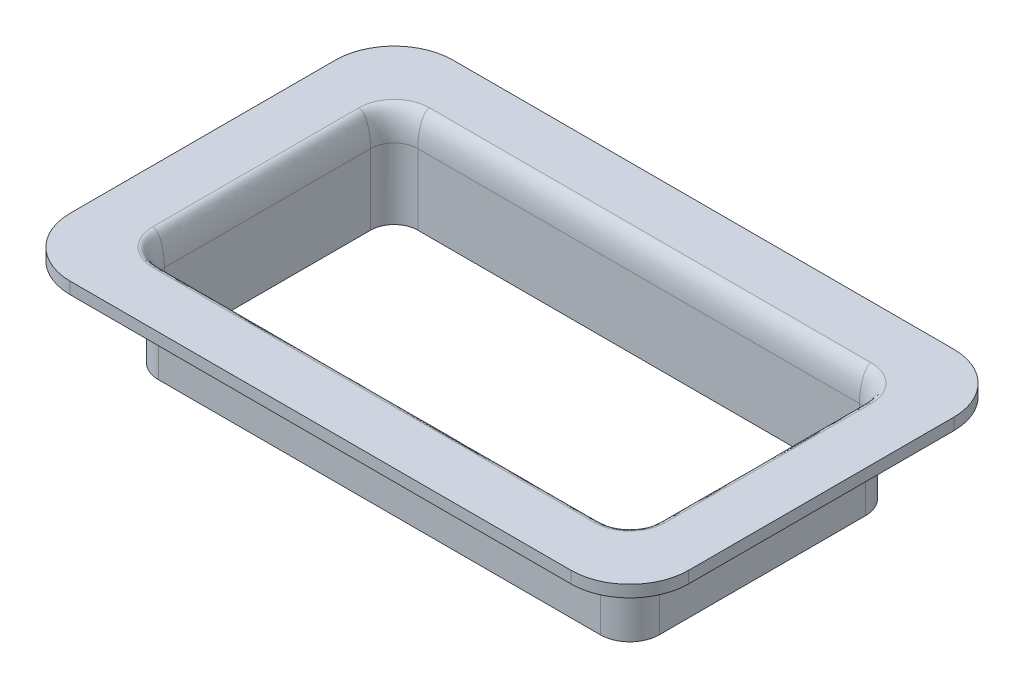
from build123d import *

# Parameters (mm, degrees)
BOSS_EXTRUDE1_DEPTH = 19.05
BOSS_EXTRUDE2_DEPTH = 2.54
FILLET1_R           = 6.35
FILLET3_SIZE        = 6.35
FILLET3_SIZE_2      = 2.54


with BuildPart() as part:
    # Sketch1 → Boss-Extrude1 (new body)
    with BuildSketch(Plane(origin=(0, 0, 0), x_dir=(1, 0, 0), z_dir=(0, 1, 0))):
        with BuildLine():
            Line((-47.625, 28.575), (47.625, 28.575))
            ThreePointArc((47.625, 28.575), (52.115128061, 26.715128061), (53.975, 22.225))
            Line((53.975, 22.225), (53.975, -22.225))
            ThreePointArc((53.975, -22.225), (52.115128061, -26.715128061), (47.625, -28.575))
            Line((47.625, -28.575), (-47.625, -28.575))
            ThreePointArc((-47.625, -28.575), (-52.115128061, -26.715128061), (-53.975, -22.225))
            Line((-53.975, -22.225), (-53.975, 22.225))
            ThreePointArc((-53.975, 22.225), (-52.115128061, 26.715128061), (-47.625, 28.575))
        make_face()
        with BuildLine():
            Line((-52.705, 22.225), (-52.705, -22.225))
            ThreePointArc((-52.705, -22.225), (-51.217102448, -25.817102448), (-47.625, -27.305))
            Line((-47.625, -27.305), (47.625, -27.305))
            ThreePointArc((47.625, -27.305), (51.217102448, -25.817102448), (52.705, -22.225))
            Line((52.705, -22.225), (52.705, 22.225))
            ThreePointArc((52.705, 22.225), (51.217102448, 25.817102448), (47.625, 27.305))
            Line((47.625, 27.305), (-47.625, 27.305))
            ThreePointArc((-47.625, 27.305), (-51.217102448, 25.817102448), (-52.705, 22.225))
        make_face(mode=Mode.SUBTRACT)
    extrude(amount=BOSS_EXTRUDE1_DEPTH)

    # Sketch2 → Boss-Extrude2 (add)
    with BuildSketch(Plane(origin=(0, 19.05, 0), x_dir=(1, 0, 0), z_dir=(0, 1, 0))):
        with BuildLine():
            Line((-53.975, -41.275), (53.975, -41.275))
            ThreePointArc((53.975, -41.275), (62.955256121, -37.555256121), (66.675, -28.575))
            Line((66.675, -28.575), (66.675, 28.575))
            ThreePointArc((66.675, 28.575), (62.955256121, 37.555256121), (53.975, 41.275))
            Line((53.975, 41.275), (-53.975, 41.275))
            ThreePointArc((-53.975, 41.275), (-62.955256121, 37.555256121), (-66.675, 28.575))
            Line((-66.675, 28.575), (-66.675, -28.575))
            ThreePointArc((-66.675, -28.575), (-62.955256121, -37.555256121), (-53.975, -41.275))
        make_face()
        with BuildLine():
            Line((52.705, -22.225), (52.705, 22.225))
            ThreePointArc((52.705, 22.225), (51.217102448, 25.817102448), (47.625, 27.305))
            Line((47.625, 27.305), (-47.625, 27.305))
            ThreePointArc((-47.625, 27.305), (-51.217102448, 25.817102448), (-52.705, 22.225))
            Line((-52.705, 22.225), (-52.705, -22.225))
            ThreePointArc((-52.705, -22.225), (-51.217102448, -25.817102448), (-47.625, -27.305))
            Line((-47.625, -27.305), (47.625, -27.305))
            ThreePointArc((47.625, -27.305), (51.217102448, -25.817102448), (52.705, -22.225))
        make_face(mode=Mode.SUBTRACT)
    extrude(amount=BOSS_EXTRUDE2_DEPTH)

    # Fillet1
    fillet1_edges = [part.edges().sort_by_distance(p)[0] for p in [
        (-52.115128061, 19.05, -26.715128061),
        (-53.975, 19.05, 0),
        (-52.115128061, 19.05, 26.715128061),
        (0, 19.05, 28.575),
        (52.115128061, 19.05, 26.715128061),
        (53.975, 19.05, 0),
        (52.115128061, 19.05, -26.715128061),
        (0, 19.05, -28.575),
    ]]
    fillet(fillet1_edges, radius=FILLET1_R)

    # Fillet3
    # an asymmetric fillet: 6.35, 2.54 mm, written as the material it takes off along each edge
    with BuildSketch(Plane(origin=(47.625, 21.59, -22.225), x_dir=(1, 0, 0), z_dir=(0, 0, 1))) as fillet3_piece_1:
        with BuildLine():
            Bezier((5.08, -FILLET3_SIZE), (5.08, 0), (5.08 + FILLET3_SIZE_2, 0), weights=[1, 0.707106781, 1])
            Line((5.08 + FILLET3_SIZE_2, 0), (5.08, 0))
            Line((5.08, 0), (5.08, -FILLET3_SIZE))
        make_face()
    revolve(axis=Axis((47.625, 21.59, -22.225), (0, 1, 0)), revolution_arc=90, mode=Mode.SUBTRACT)
    with BuildSketch(Plane(origin=(52.705, 21.59, 22.225), x_dir=(0, -1, 0), z_dir=(0, 0, -1)), Plane(origin=(-52.705, 21.59, -22.225), x_dir=(0, -1, 0), z_dir=(0, 0, 1))) as fillet3_piece_2:
        with BuildLine():
            Bezier((FILLET3_SIZE, 0), (0, 0), (0, -FILLET3_SIZE_2), weights=[1, 0.707106781, 1])
            Line((0, -FILLET3_SIZE_2), (0, 0))
            Line((0, 0), (FILLET3_SIZE, 0))
        make_face()
    extrude(amount=44.45, mode=Mode.SUBTRACT)
    with BuildSketch(Plane(origin=(47.625, 21.59, 22.225), x_dir=(0, 0, 1), z_dir=(-1, 0, 0))) as fillet3_piece_3:
        with BuildLine():
            Bezier((5.08, -FILLET3_SIZE), (5.08, 0), (5.08 + FILLET3_SIZE_2, 0), weights=[1, 0.707106781, 1])
            Line((5.08 + FILLET3_SIZE_2, 0), (5.08, 0))
            Line((5.08, 0), (5.08, -FILLET3_SIZE))
        make_face()
    revolve(axis=Axis((47.625, 21.59, 22.225), (0, 1, 0)), revolution_arc=90, mode=Mode.SUBTRACT)
    with BuildSketch(Plane(origin=(-47.625, 21.59, 27.305), x_dir=(0, -1, 0), z_dir=(1, 0, 0)), Plane(origin=(47.625, 21.59, -27.305), x_dir=(0, -1, 0), z_dir=(-1, 0, 0))) as fillet3_piece_4:
        with BuildLine():
            Bezier((FILLET3_SIZE, 0), (0, 0), (0, -FILLET3_SIZE_2), weights=[1, 0.707106781, 1])
            Line((0, -FILLET3_SIZE_2), (0, 0))
            Line((0, 0), (FILLET3_SIZE, 0))
        make_face()
    extrude(amount=95.25, mode=Mode.SUBTRACT)
    with BuildSketch(Plane(origin=(-47.625, 21.59, 22.225), x_dir=(-1, 0, 0), z_dir=(0, 0, -1))) as fillet3_piece_5:
        with BuildLine():
            Bezier((5.08, -FILLET3_SIZE), (5.08, 0), (5.08 + FILLET3_SIZE_2, 0), weights=[1, 0.707106781, 1])
            Line((5.08 + FILLET3_SIZE_2, 0), (5.08, 0))
            Line((5.08, 0), (5.08, -FILLET3_SIZE))
        make_face()
    revolve(axis=Axis((-47.625, 21.59, 22.225), (0, 1, 0)), revolution_arc=90, mode=Mode.SUBTRACT)
    with BuildSketch(Plane(origin=(-47.625, 21.59, -22.225), x_dir=(0, 0, -1), z_dir=(1, 0, 0))) as fillet3_piece_6:
        with BuildLine():
            Bezier((5.08, -FILLET3_SIZE), (5.08, 0), (5.08 + FILLET3_SIZE_2, 0), weights=[1, 0.707106781, 1])
            Line((5.08 + FILLET3_SIZE_2, 0), (5.08, 0))
            Line((5.08, 0), (5.08, -FILLET3_SIZE))
        make_face()
    revolve(axis=Axis((-47.625, 21.59, -22.225), (0, 1, 0)), revolution_arc=90, mode=Mode.SUBTRACT)


solid = part.part
